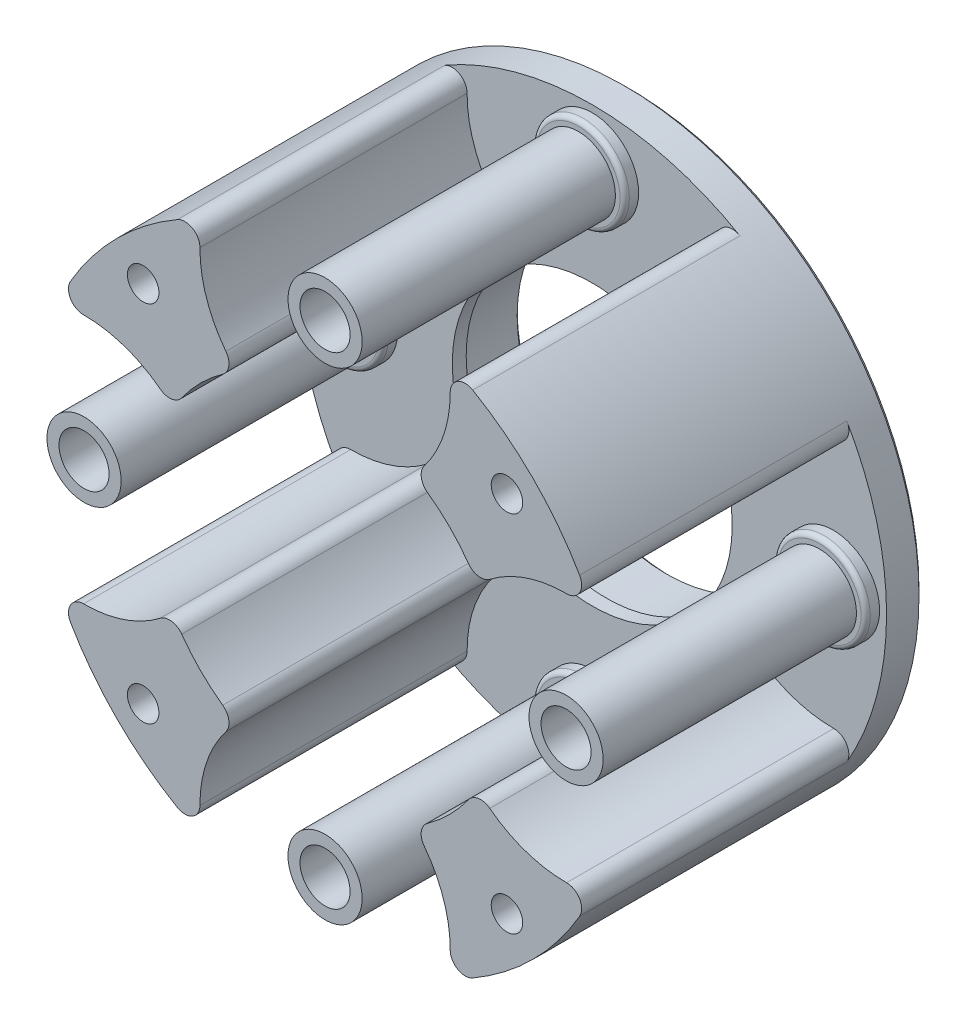
from build123d import *

# Parameters (mm, degrees)
SKETCH1_R               = 31.75
SKETCH1_R_2             = 2.7
SKETCH1_R_3             = 2.6999999999999793
SKETCH1_R_4             = 2.699999999999988
SKETCH1_R_5             = 2.7000000000000046
BOSS_EXTRUDE1_DEPTH     = 4
SKETCH2_R               = 4.000000000000011
SKETCH2_R_2             = 2.7
BOSS_EXTRUDE2_DEPTH     = 28.823381129999998
SKETCH3_R               = 5.000000000000011
SKETCH3_R_2             = 4.000000000000011
BOSS_EXTRUDE3_DEPTH     = 1.5
BOSS_EXTRUDE4_DEPTH     = 28.823381129999998
FILLET2_R               = 0.5
FILLET5_R               = 1.61977879287575
CIRPATTERN1_START       = 4
CIRPATTERN1_DEPTH       = 28.82338113
CHAMFER1_SIZE           = 0.5
SKETCH9_R               = 8
CUT_EXTRUDE4_DEPTH      = 54.35646463391214
BOSS_EXTRUDE7_START     = -6.5
SKETCH10_R              = 8
SKETCH10_R_2            = 6.500000000000002
BOSS_EXTRUDE7_DEPTH     = 6.5
CUT_EXTRUDE5_DEPTH      = 54.35646463391214
CUT_EXTRUDE5_DEPTH_BACK = 54.35646463391214
SKETCH14_R              = 16.1
SKETCH15_R              = 16.1
SKETCH15_R_2            = 15.1
BOSS_EXTRUDE8_DEPTH     = 1.5
SKETCH16_R              = 18.099999999999998
SKETCH16_R_2            = 16.1
BOSS_EXTRUDE9_DEPTH     = 4.5
CHAMFER3_SIZE2          = 4.5
CHAMFER3_SIZE           = 2
SKETCH5_R               = 1.6999999999999995
CUT_EXTRUDE1_DEPTH      = 59.38801068434546
CUT_EXTRUDE3_START      = -5
SKETCH7_R               = 4.45
CUT_EXTRUDE3_DEPTH      = 61.61923559408127
CUT_EXTRUDE2_START      = -3
SKETCH6_R               = 2.949999999999982
CUT_EXTRUDE2_DEPTH      = 59.61923559408127
CIRPATTERN2_COUNT       = 4
CHAMFER4_SIZE           = 0.5


# Read off the part's stored shape, not the designer's step: CirPattern1
with BuildPart() as part:
    # Sketch1 → Boss-Extrude1 (new body)
    with BuildSketch(Plane.XY):
        Circle(SKETCH1_R)
        with Locations((0, 26)):
            Circle(SKETCH1_R_2, mode=Mode.SUBTRACT)
        with Locations((26, 1.59e-15)):
            Circle(SKETCH1_R_3, mode=Mode.SUBTRACT)
        with Locations((3.18e-15, -26)):
            Circle(SKETCH1_R_4, mode=Mode.SUBTRACT)
        with Locations((-26, 1.59e-15)):
            Circle(SKETCH1_R_5, mode=Mode.SUBTRACT)
    extrude(amount=BOSS_EXTRUDE1_DEPTH)

    # Sketch2 → Boss-Extrude2 (add)
    with BuildSketch(Plane.XY.offset(4)):
        with Locations((0, 26)):
            Circle(SKETCH2_R)
        with Locations((0, 26)):
            Circle(SKETCH2_R_2, mode=Mode.SUBTRACT)
    extrude(amount=BOSS_EXTRUDE2_DEPTH)

    # Sketch3 → Boss-Extrude3 (add)
    with BuildSketch(Plane.XY.offset(4)):
        with Locations((0, 26)):
            Circle(SKETCH3_R)
        with Locations((0, 26)):
            Circle(SKETCH3_R_2, mode=Mode.SUBTRACT)
    extrude(amount=BOSS_EXTRUDE3_DEPTH)

    # Sketch4 → Boss-Extrude4 (add)
    with BuildSketch(Plane.XY.offset(4)):
        with BuildLine():
            ThreePointArc((-9.529354319679797, 16.437499999999996), (-12.951492793939106, 22.190953609032412), (-13.189002373040246, 28.881009615384613))
            ThreePointArc((-13.189002373040248, 28.881009615384617), (-22.45064030267292, 22.450640302672845), (-28.88100961538466, 13.189002373040152))
            ThreePointArc((-28.88100961538466, 13.18900237304014), (-22.19095360903246, 12.951492793939027), (-16.437500000000036, 9.529354319679738))
            ThreePointArc((-16.437500000000036, 9.529354319679735), (-13.435028842544424, 13.43502884254438), (-9.529354319679797, 16.4375))
        make_face()
    extrude(amount=BOSS_EXTRUDE4_DEPTH)

    # Fillet2
    fillet2_edges = [part.edges().sort_by_distance(p)[0] for p in [
        (-5.000000000000011, 26, 5.5),
    ]]
    fillet(fillet2_edges, radius=FILLET2_R)

    # Fillet5
    fillet5_edges = [part.edges().sort_by_distance(p)[0] for p in [
        (-13.189002373040246, 28.881009615384613, 18.411690565),
        (-28.881009615384663, 13.189002373040147, 18.411690565),
        (-16.437500000000036, 9.529354319679737, 18.411690565),
        (-9.529354319679797, 16.4375, 18.411690565),
    ]]
    fillet(fillet5_edges, radius=FILLET5_R)

    # CirPattern1 outline → CirPattern1 (add)
    with BuildSketch(Plane.XY.offset(CIRPATTERN1_START)):
        with BuildLine():
            ThreePointArc((-15.461987637, -11.042053175), (-16.542214144, -10.381196466), (-17.767866629, -10.699625235))
            ThreePointArc((-17.767866629, -10.699625235), (-21.67849749, -12.789629238), (-26.055332527, -13.499886604))
            ThreePointArc((-26.055332527, -13.499886604), (-27.463927582, -14.308354959), (-27.463044171, -15.932473282))
            ThreePointArc((-27.463044171, -15.932473282), (-22.450640303, -22.450640303), (-15.932473282, -27.463044171))
            ThreePointArc((-15.932473282, -27.463044171), (-14.308354959, -27.463927582), (-13.499886604, -26.055332527))
            ThreePointArc((-13.499886604, -26.055332527), (-12.789629238, -21.67849749), (-10.699625235, -17.767866629))
            ThreePointArc((-10.699625235, -17.767866629), (-10.381196466, -16.542214144), (-11.042053175, -15.461987637))
            ThreePointArc((-11.042053175, -15.461987637), (-13.435028843, -13.435028843), (-15.461987637, -11.042053175))
        make_face()
        with BuildLine():
            ThreePointArc((27.463044171, 15.932473282), (22.450640303, 22.450640303), (15.932473282, 27.463044171))
            ThreePointArc((15.932473282, 27.463044171), (14.308354959, 27.463927582), (13.499886604, 26.055332527))
            ThreePointArc((13.499886604, 26.055332527), (12.789629238, 21.67849749), (10.699625235, 17.767866629))
            ThreePointArc((10.699625235, 17.767866629), (10.381196466, 16.542214144), (11.042053175, 15.461987637))
            ThreePointArc((11.042053175, 15.461987637), (13.435028843, 13.435028843), (15.461987637, 11.042053175))
            ThreePointArc((15.461987637, 11.042053175), (16.542214144, 10.381196466), (17.767866629, 10.699625235))
            ThreePointArc((17.767866629, 10.699625235), (21.67849749, 12.789629238), (26.055332527, 13.499886604))
            ThreePointArc((26.055332527, 13.499886604), (27.463927582, 14.308354959), (27.463044171, 15.932473282))
        make_face()
        with BuildLine():
            ThreePointArc((13.499886604, -26.055332527), (14.308354959, -27.463927582), (15.932473282, -27.463044171))
            ThreePointArc((15.932473282, -27.463044171), (22.450640303, -22.450640303), (27.463044171, -15.932473282))
            ThreePointArc((27.463044171, -15.932473282), (27.463927582, -14.308354959), (26.055332527, -13.499886604))
            ThreePointArc((26.055332527, -13.499886604), (21.67849749, -12.789629238), (17.767866629, -10.699625235))
            ThreePointArc((17.767866629, -10.699625235), (16.542214144, -10.381196466), (15.461987637, -11.042053175))
            ThreePointArc((15.461987637, -11.042053175), (13.435028843, -13.435028843), (11.042053175, -15.461987637))
            ThreePointArc((11.042053175, -15.461987637), (10.381196466, -16.542214144), (10.699625235, -17.767866629))
            ThreePointArc((10.699625235, -17.767866629), (12.789629238, -21.67849749), (13.499886604, -26.055332527))
        make_face()
    extrude(amount=CIRPATTERN1_DEPTH)

    # CirPattern1 2 outline → CirPattern1 2 (revolve)
    with BuildSketch(Plane(origin=(-26, 0, 0), x_dir=(1, 0, 0), z_dir=(0, -1, 0))):
        with BuildLine():
            Line((4, 32.82338113), (2.7, 32.82338113))
            Line((2.7, 32.82338113), (2.7, 4))
            Line((2.7, 4), (5, 4))
            Line((5, 4), (5, 5))
            ThreePointArc((5, 5), (4.853553391, 5.353553391), (4.5, 5.5))
            Line((4.5, 5.5), (4, 5.5))
            Line((4, 5.5), (4, 32.82338113))
        make_face()
    revolve(axis=Axis((-26, 0, 0), (0, 0, 1)))

    # CirPattern1 3 outline → CirPattern1 3 (revolve)
    with BuildSketch(Plane.XZ.offset(26)):
        with BuildLine():
            Line((4, 32.82338113), (2.7, 32.82338113))
            Line((2.7, 32.82338113), (2.7, 4))
            Line((2.7, 4), (5, 4))
            Line((5, 4), (5, 5))
            ThreePointArc((5, 5), (4.853553391, 5.353553391), (4.5, 5.5))
            Line((4.5, 5.5), (4, 5.5))
            Line((4, 5.5), (4, 32.82338113))
        make_face()
    revolve(axis=Axis((0, -26, 0), (0, 0, 1)))

    # CirPattern1 4 outline → CirPattern1 4 (revolve)
    with BuildSketch(Plane(origin=(26, 0, 0), x_dir=(1, 0, 0), z_dir=(0, -1, 0))):
        with BuildLine():
            Line((4, 32.82338113), (2.7, 32.82338113))
            Line((2.7, 32.82338113), (2.7, 4))
            Line((2.7, 4), (5, 4))
            Line((5, 4), (5, 5))
            ThreePointArc((5, 5), (4.853553391, 5.353553391), (4.5, 5.5))
            Line((4.5, 5.5), (4, 5.5))
            Line((4, 5.5), (4, 32.82338113))
        make_face()
    revolve(axis=Axis((26, 0, 0), (0, 0, 1)))

    # Chamfer1
    chamfer1_edges = [part.edges().sort_by_distance(p)[0] for p in [
        (-31.75, 3.89e-15, 0),
    ]]
    chamfer(chamfer1_edges, length=CHAMFER1_SIZE)

    # Sketch9 → Cut-Extrude4 (cut, through all)
    with BuildSketch(Plane.XY.offset(4)):
        Circle(SKETCH9_R)
    extrude(amount=-CUT_EXTRUDE4_DEPTH, mode=Mode.SUBTRACT)

    # Sketch10 → Boss-Extrude7 (add)
    with BuildSketch(Plane(origin=(0, 0, 0), x_dir=(-1, 0, 0), z_dir=(0, 0, -1)).offset(BOSS_EXTRUDE7_START)):
        Circle(SKETCH10_R)
        Circle(SKETCH10_R_2, mode=Mode.SUBTRACT)
    extrude(amount=BOSS_EXTRUDE7_DEPTH)

    # Sketch14 → Cut-Extrude5 (cut, two sides: drawn at the far end of the back side and taken through both)
    with BuildSketch(Plane.XY.offset(4).offset(-CUT_EXTRUDE5_DEPTH_BACK)):
        Circle(SKETCH14_R)
    extrude(amount=CUT_EXTRUDE5_DEPTH + CUT_EXTRUDE5_DEPTH_BACK, mode=Mode.SUBTRACT)

    # Sketch15 → Boss-Extrude8 (add)
    with BuildSketch(Plane.XY.offset(4)):
        Circle(SKETCH15_R)
        Circle(SKETCH15_R_2, mode=Mode.SUBTRACT)
    extrude(amount=-BOSS_EXTRUDE8_DEPTH)

    # Sketch16 → Boss-Extrude9 (add)
    with BuildSketch(Plane(origin=(0, 0, 0), x_dir=(-1, 0, 0), z_dir=(0, 0, -1))):
        with Locations(Location((0, 0, 0), (0, 0, 180))):
            Circle(SKETCH16_R)
        with Locations(Location((0, 0, 0), (0, 0, 180))):
            Circle(SKETCH16_R_2, mode=Mode.SUBTRACT)
    extrude(amount=BOSS_EXTRUDE9_DEPTH)

    # Chamfer3
    chamfer3_edges = [part.edges().sort_by_distance(p)[0] for p in [
        (-18.099999999999998, -4.43e-15, 0),
    ]]
    chamfer3_side = [part.faces().sort_by_distance(p)[0] for p in [
        (-18.139999999999997, -4.44e-15, 0),
    ]]
    chamfer(chamfer3_edges, length=CHAMFER3_SIZE - 0.0001, length2=CHAMFER3_SIZE2 - 0.0001, reference=chamfer3_side[0])  # a hair under: the kernel refuses the full size

    # Sketch5 → Cut-Extrude1 (cut, through all)
    with BuildSketch(Plane.XY.offset(32.823381129999994)):
        with Locations((-19.622213177926728, 19.622213177926657)):
            Circle(SKETCH5_R)
    cut_extrude1 = extrude(amount=-CUT_EXTRUDE1_DEPTH, mode=Mode.SUBTRACT)

    # Sketch7 → Cut-Extrude3 (cut)
    with BuildSketch(Plane(origin=(0, 0, 0), x_dir=(-1, 0, 0), z_dir=(0, 0, -1)).offset(CUT_EXTRUDE3_START)):
        with Locations(Location((0, 26, 0), (0, 0, 180))):
            Circle(SKETCH7_R)
    cut_extrude3 = extrude(amount=CUT_EXTRUDE3_DEPTH, mode=Mode.SUBTRACT)

    # Sketch6 → Cut-Extrude2 (cut)
    with BuildSketch(Plane(origin=(0, 0, 0), x_dir=(-1, 0, 0), z_dir=(0, 0, -1)).offset(CUT_EXTRUDE2_START)):
        with Locations(Location((19.622213177926728, 19.622213177926657, 0), (0, 0, 180))):
            Circle(SKETCH6_R)
    cut_extrude2 = extrude(amount=CUT_EXTRUDE2_DEPTH, mode=Mode.SUBTRACT)

    # CirPattern2: Cut-Extrude1, Cut-Extrude3, Cut-Extrude2 ×4 about axis
    cirpattern2_axis = Axis((-3.768e-14, -2.255e-14, 0), (0, 0, 1))
    add([cut_extrude1.rotate(cirpattern2_axis, i * 360 / CIRPATTERN2_COUNT) for i in range(1, CIRPATTERN2_COUNT)], mode=Mode.SUBTRACT)
    add([cut_extrude3.rotate(cirpattern2_axis, i * 360 / CIRPATTERN2_COUNT) for i in range(1, CIRPATTERN2_COUNT)], mode=Mode.SUBTRACT)
    add([cut_extrude2.rotate(cirpattern2_axis, i * 360 / CIRPATTERN2_COUNT) for i in range(1, CIRPATTERN2_COUNT)], mode=Mode.SUBTRACT)

    # Chamfer4
    chamfer4_edges = [part.edges().sort_by_distance(p)[0] for p in [
        (-16.1, -3.94e-15, -4.5),
    ]]
    chamfer(chamfer4_edges, length=CHAMFER4_SIZE)


solid = part.part
